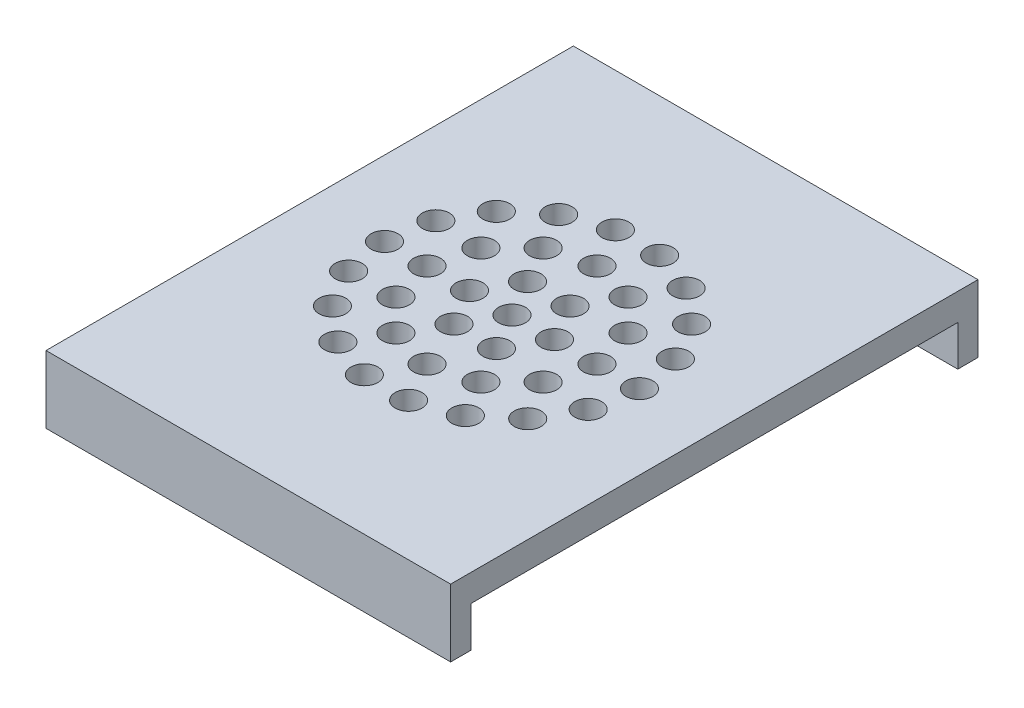
from build123d import *

# Parameters (mm, degrees)
SKIZZE1_W                       = 60
SKIZZE1_H                       = 72.2
AUFSATZ_LINEAR_AUSTRAGEN1_DEPTH = 4
AUFSATZ_LINEAR_START            = -6
SKIZZE2_W                       = 60
SKIZZE2_H                       = 3
AUFSATZ_LINEAR_AUSTRAGEN2_DEPTH = 10
SKIZZE4_R                       = 2
SCHNITT_LINEAR_AUSTRAGEN1_DEPTH = 51.287274732
F_LLMUSTER1_OUTLINE_R           = 2
F_LLMUSTER1_DEPTH               = 4


# Read off the part's stored shape, not the designer's step: Füllmuster1
with BuildPart() as part:
    # Skizze1 → Aufsatz-Linear austragen1 (new body)
    with BuildSketch(Plane(origin=(0, 0, 0), x_dir=(1, 0, 0), z_dir=(0, 1, 0))):
        Rectangle(SKIZZE1_W, SKIZZE1_H)
    extrude(amount=AUFSATZ_LINEAR_AUSTRAGEN1_DEPTH)

    # Skizze2 → Aufsatz-Linear austragen2 (add)
    with BuildSketch(Plane(origin=(0, 0, 0), x_dir=(1, 0, 0), z_dir=(0, 1, 0)).offset(AUFSATZ_LINEAR_START)):
        with Locations((0, 37.6)):
            Rectangle(SKIZZE2_W, SKIZZE2_H)
    aufsatz_linear_austragen2 = extrude(amount=AUFSATZ_LINEAR_AUSTRAGEN2_DEPTH)

    # Spiegeln1: Aufsatz-Linear austragen2 across plane
    add(aufsatz_linear_austragen2.mirror(Plane.XY))

    # Skizze4 → Schnitt-Linear austragen1 (cut, through all)
    with BuildSketch(Plane(origin=(0, 4, 0), x_dir=(1, 0, 0), z_dir=(0, 1, 0))):
        with Locations(Location((0, 0, 0), (0, 0, 270))):
            Circle(SKIZZE4_R)
    extrude(amount=-SCHNITT_LINEAR_AUSTRAGEN1_DEPTH, mode=Mode.SUBTRACT)

    # Füllmuster1 outline → Füllmuster1 (cut)
    with BuildSketch(Plane(origin=(0, 0, 0), x_dir=(1, 0, 0), z_dir=(0, 1, 0))):
        with Locations((6.3, 0)):
            Circle(F_LLMUSTER1_OUTLINE_R)
        with Locations((17.760190533, 6.464180709)):
            Circle(F_LLMUSTER1_OUTLINE_R)
        with Locations((14.478239975, 12.148685823)):
            Circle(F_LLMUSTER1_OUTLINE_R)
        with Locations((9.45, 16.367880132)):
            Circle(F_LLMUSTER1_OUTLINE_R)
        with Locations((6.3, 10.911920088)):
            Circle(F_LLMUSTER1_OUTLINE_R)
        with Locations((0, 12.6)):
            Circle(F_LLMUSTER1_OUTLINE_R)
        with Locations((-6.3, 10.911920088)):
            Circle(F_LLMUSTER1_OUTLINE_R)
        with Locations((-10.911920088, 6.3)):
            Circle(F_LLMUSTER1_OUTLINE_R)
        with Locations((-12.6, 0)):
            Circle(F_LLMUSTER1_OUTLINE_R)
        with Locations((-10.911920088, -6.3)):
            Circle(F_LLMUSTER1_OUTLINE_R)
        with Locations((-6.3, -10.911920088)):
            Circle(F_LLMUSTER1_OUTLINE_R)
        with Locations((0, -12.6)):
            Circle(F_LLMUSTER1_OUTLINE_R)
        with Locations((3.15, -5.455960044)):
            Circle(F_LLMUSTER1_OUTLINE_R)
        with Locations((-3.15, -5.455960044)):
            Circle(F_LLMUSTER1_OUTLINE_R)
        with Locations((-6.3, 0)):
            Circle(F_LLMUSTER1_OUTLINE_R)
        with Locations((-3.15, 5.455960044)):
            Circle(F_LLMUSTER1_OUTLINE_R)
        with Locations((3.15, 5.455960044)):
            Circle(F_LLMUSTER1_OUTLINE_R)
        with Locations((12.6, 0)):
            Circle(F_LLMUSTER1_OUTLINE_R)
        with Locations((10.911920088, -6.3)):
            Circle(F_LLMUSTER1_OUTLINE_R)
        with Locations((6.3, -10.911920088)):
            Circle(F_LLMUSTER1_OUTLINE_R)
        with Locations((3.281950558, 18.612866532)):
            Circle(F_LLMUSTER1_OUTLINE_R)
        with Locations((-3.281950558, 18.612866532)):
            Circle(F_LLMUSTER1_OUTLINE_R)
        with Locations((-9.45, 16.367880132)):
            Circle(F_LLMUSTER1_OUTLINE_R)
        with Locations((-14.478239975, 12.148685823)):
            Circle(F_LLMUSTER1_OUTLINE_R)
        with Locations((-17.760190533, 6.464180709)):
            Circle(F_LLMUSTER1_OUTLINE_R)
        with Locations((-18.9, 0)):
            Circle(F_LLMUSTER1_OUTLINE_R)
        with Locations((-17.760190533, -6.464180709)):
            Circle(F_LLMUSTER1_OUTLINE_R)
        with Locations((-14.478239975, -12.148685823)):
            Circle(F_LLMUSTER1_OUTLINE_R)
        with Locations((-9.45, -16.367880132)):
            Circle(F_LLMUSTER1_OUTLINE_R)
        with Locations((-3.281950558, -18.612866532)):
            Circle(F_LLMUSTER1_OUTLINE_R)
        with Locations((3.281950558, -18.612866532)):
            Circle(F_LLMUSTER1_OUTLINE_R)
        with Locations((9.45, -16.367880132)):
            Circle(F_LLMUSTER1_OUTLINE_R)
        with Locations((14.478239975, -12.148685823)):
            Circle(F_LLMUSTER1_OUTLINE_R)
        with Locations((17.760190533, -6.464180709)):
            Circle(F_LLMUSTER1_OUTLINE_R)
        with Locations((18.9, 0)):
            Circle(F_LLMUSTER1_OUTLINE_R)
        with Locations((10.911920088, 6.3)):
            Circle(F_LLMUSTER1_OUTLINE_R)
    extrude(amount=F_LLMUSTER1_DEPTH, mode=Mode.SUBTRACT)


solid = part.part
